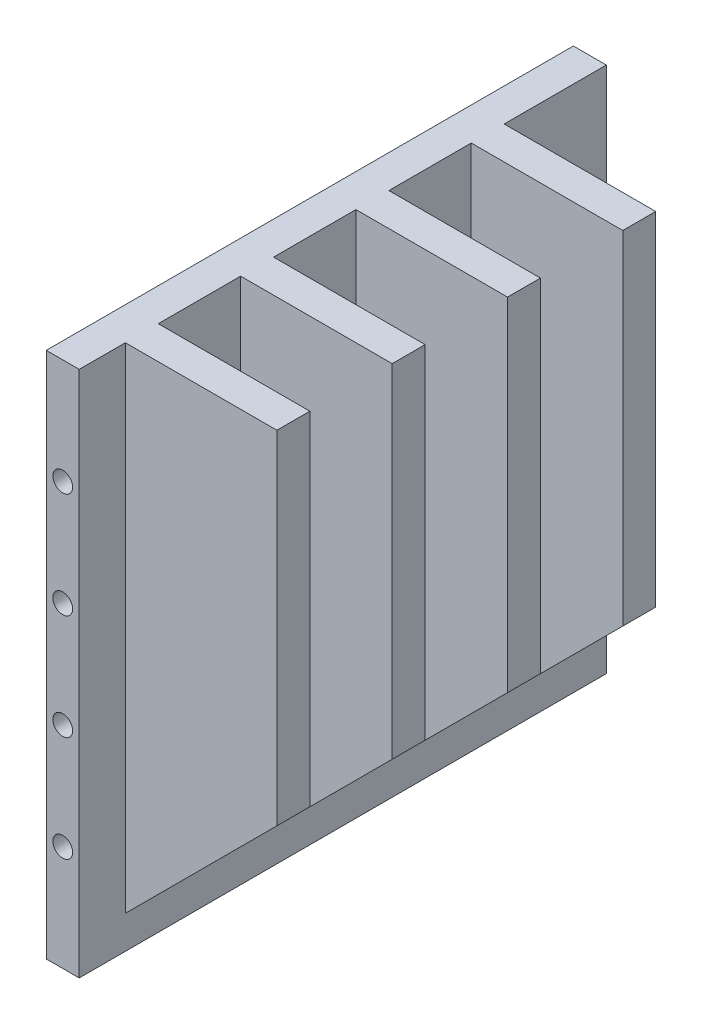
from build123d import *

# Parameters (mm, degrees)
BOSS_EXTRUDE1_DEPTH = 101.6
SKETCH2_R           = 1.905
CUT_EXTRUDE1_DEPTH  = 4.826
SKETCH5_W           = 29.21
SKETCH5_H           = 6.35
BOSS_EXTRUDE2_DEPTH = 57.15
CHAMFER1_SIZE       = 38.1
CUT_EXTRUDE2_START  = -101.6
SKETCH2_2_R         = 1.905
CUT_EXTRUDE2_DEPTH  = 4.826


with BuildPart() as part:
    # Sketch1 → Boss-Extrude1 (new body)
    with BuildSketch(Plane(origin=(0, 0, 0), x_dir=(1, 0, 0), z_dir=(0, 1, 0))):
        Polygon((0, -19.05), (0, 19.05), (0, 52.07), (6.35, 52.07), (6.35, 19.05), (6.35, -19.05), (6.35, -49.53), (0, -49.53), align=None)
    extrude(amount=BOSS_EXTRUDE1_DEPTH)

    # Sketch2 → Cut-Extrude1 (cut)
    with BuildSketch(Plane.XY.offset(49.53)):
        with Locations((3.175, 81.28)):
            Circle(SKETCH2_R)
        with Locations((3.175, 60.96)):
            Circle(SKETCH2_R)
        with Locations((3.175, 20.32)):
            Circle(SKETCH2_R)
        with Locations((3.175, 40.64)):
            Circle(SKETCH2_R)
    cut_extrude1 = extrude(amount=-CUT_EXTRUDE1_DEPTH, mode=Mode.SUBTRACT)

    # Mirror1: Cut-Extrude1 across plane
    add(cut_extrude1.mirror(Plane.XY), mode=Mode.SUBTRACT)

    # Sketch5 → Boss-Extrude2 (add)
    with BuildSketch(Plane(origin=(0, 101.6, 0), x_dir=(1, 0, 0), z_dir=(0, 1, 0))):
        with Locations((20.955, 29.21)):
            Rectangle(SKETCH5_W, SKETCH5_H)
        with Locations((20.955, 6.985)):
            Rectangle(SKETCH5_W, SKETCH5_H)
        with Locations((20.955, -15.24)):
            Rectangle(SKETCH5_W, SKETCH5_H)
        with Locations((20.955, -37.465)):
            Rectangle(SKETCH5_W, SKETCH5_H)
    extrude(amount=-BOSS_EXTRUDE2_DEPTH)

    # Chamfer1
    # the kernel refuses this chamfer: 38.1 mm, written as the material it adds along each edge
    with BuildSketch(Plane(origin=(6.35, 44.45, 71.946121842), x_dir=(-0.02749587661058638, -0.9996219169112968, 0), z_dir=(0, 0, -1))) as chamfer1_piece_1_section:
        Polygon((CHAMFER1_SIZE * 0.999621916911, -CHAMFER1_SIZE * 0.0274958766106), (-CHAMFER1_SIZE * 0.0274958766106, -CHAMFER1_SIZE * 0.999621916911), (0, 0), align=None)
    chamfer1_piece_1 = extrude(amount=104.331121842, mode=Mode.PRIVATE)
    chamfer1_piece_1 = split(chamfer1_piece_1, bisect_by=Plane(origin=(17.461394365, 31.123016765, 40.64), z_dir=(0, 0, -1)), keep=Keep.TOP, mode=Mode.PRIVATE)
    chamfer1_piece_1 = split(chamfer1_piece_1, bisect_by=Plane(origin=(17.461394365, 31.123016765, 34.29), z_dir=(0, 0, 1)), keep=Keep.TOP, mode=Mode.PRIVATE)
    chamfer1_piece_1 = split(chamfer1_piece_1, bisect_by=Plane(origin=(35.56, 31.123016765, 37.465), z_dir=(-1, 0, 0)), keep=Keep.TOP, mode=Mode.PRIVATE)
    add(chamfer1_piece_1)
    with BuildSketch(Plane(origin=(6.35, 44.45, 71.946121842), x_dir=(-0.02749587661058638, -0.9996219169112968, 0), z_dir=(0, 0, -1))) as chamfer1_piece_2_section:
        Polygon((CHAMFER1_SIZE * 0.999621916911, -CHAMFER1_SIZE * 0.0274958766106), (-CHAMFER1_SIZE * 0.0274958766106, -CHAMFER1_SIZE * 0.999621916911), (0, 0), align=None)
    chamfer1_piece_2 = extrude(amount=104.331121842, mode=Mode.PRIVATE)
    chamfer1_piece_2 = split(chamfer1_piece_2, bisect_by=Plane(origin=(35.56, 31.123016765, 15.24), z_dir=(-1, 0, 0)), keep=Keep.TOP, mode=Mode.PRIVATE)
    chamfer1_piece_2 = split(chamfer1_piece_2, bisect_by=Plane(origin=(17.461394365, 31.123016765, 18.415), z_dir=(0, 0, -1)), keep=Keep.TOP, mode=Mode.PRIVATE)
    chamfer1_piece_2 = split(chamfer1_piece_2, bisect_by=Plane(origin=(17.461394365, 31.123016765, 12.065), z_dir=(0, 0, 1)), keep=Keep.TOP, mode=Mode.PRIVATE)
    add(chamfer1_piece_2)
    with BuildSketch(Plane(origin=(6.35, 44.45, 71.946121842), x_dir=(-0.02749587661058638, -0.9996219169112968, 0), z_dir=(0, 0, -1))) as chamfer1_piece_3_section:
        Polygon((CHAMFER1_SIZE * 0.999621916911, -CHAMFER1_SIZE * 0.0274958766106), (-CHAMFER1_SIZE * 0.0274958766106, -CHAMFER1_SIZE * 0.999621916911), (0, 0), align=None)
    chamfer1_piece_3 = extrude(amount=104.331121842, mode=Mode.PRIVATE)
    chamfer1_piece_3 = split(chamfer1_piece_3, bisect_by=Plane(origin=(35.56, 31.123016765, -6.985), z_dir=(-1, 0, 0)), keep=Keep.TOP, mode=Mode.PRIVATE)
    chamfer1_piece_3 = split(chamfer1_piece_3, bisect_by=Plane(origin=(17.461394365, 31.123016765, -3.81), z_dir=(0, 0, -1)), keep=Keep.TOP, mode=Mode.PRIVATE)
    chamfer1_piece_3 = split(chamfer1_piece_3, bisect_by=Plane(origin=(17.461394365, 31.123016765, -10.16), z_dir=(0, 0, 1)), keep=Keep.TOP, mode=Mode.PRIVATE)
    add(chamfer1_piece_3)
    with BuildSketch(Plane(origin=(6.35, 44.45, -26.035), x_dir=(-0.027495876610586018, -0.9996219169112968, 0), z_dir=(0, 0, -1))) as chamfer1_piece_4_section:
        Polygon((CHAMFER1_SIZE * 0.999621916911, -CHAMFER1_SIZE * 0.0274958766106), (-CHAMFER1_SIZE * 0.0274958766106, -CHAMFER1_SIZE * 0.999621916911), (0, 0), align=None)
    chamfer1_piece_4 = extrude(amount=6.35, mode=Mode.PRIVATE)
    chamfer1_piece_4 = split(chamfer1_piece_4, bisect_by=Plane(origin=(35.56, 31.123016765, -29.21), z_dir=(-1, 0, 0)), keep=Keep.TOP, mode=Mode.PRIVATE)
    add(chamfer1_piece_4)
    with BuildSketch(Plane(origin=(6.35, 44.45, 94.171121842), x_dir=(-0.02749587661058638, -0.9996219169112968, 0), z_dir=(0, 0, -1))) as chamfer1_piece_5_section:
        Polygon((CHAMFER1_SIZE * 0.999621916911, -CHAMFER1_SIZE * 0.0274958766106), (-CHAMFER1_SIZE * 0.0274958766106, -CHAMFER1_SIZE * 0.999621916911), (0, 0), align=None)
    chamfer1_piece_5 = extrude(amount=104.331121842, mode=Mode.PRIVATE)
    chamfer1_piece_5 = split(chamfer1_piece_5, bisect_by=Plane(origin=(17.461394365, 31.123016765, 40.64), z_dir=(0, 0, -1)), keep=Keep.TOP, mode=Mode.PRIVATE)
    chamfer1_piece_5 = split(chamfer1_piece_5, bisect_by=Plane(origin=(17.461394365, 31.123016765, 34.29), z_dir=(0, 0, 1)), keep=Keep.TOP, mode=Mode.PRIVATE)
    chamfer1_piece_5 = split(chamfer1_piece_5, bisect_by=Plane(origin=(35.56, 31.123016765, 37.465), z_dir=(-1, 0, 0)), keep=Keep.TOP, mode=Mode.PRIVATE)
    add(chamfer1_piece_5)
    with BuildSketch(Plane(origin=(6.35, 44.45, 94.171121842), x_dir=(-0.02749587661058638, -0.9996219169112968, 0), z_dir=(0, 0, -1))) as chamfer1_piece_6_section:
        Polygon((CHAMFER1_SIZE * 0.999621916911, -CHAMFER1_SIZE * 0.0274958766106), (-CHAMFER1_SIZE * 0.0274958766106, -CHAMFER1_SIZE * 0.999621916911), (0, 0), align=None)
    chamfer1_piece_6 = extrude(amount=104.331121842, mode=Mode.PRIVATE)
    chamfer1_piece_6 = split(chamfer1_piece_6, bisect_by=Plane(origin=(35.56, 31.123016765, 15.24), z_dir=(-1, 0, 0)), keep=Keep.TOP, mode=Mode.PRIVATE)
    chamfer1_piece_6 = split(chamfer1_piece_6, bisect_by=Plane(origin=(17.461394365, 31.123016765, 18.415), z_dir=(0, 0, -1)), keep=Keep.TOP, mode=Mode.PRIVATE)
    chamfer1_piece_6 = split(chamfer1_piece_6, bisect_by=Plane(origin=(17.461394365, 31.123016765, 12.065), z_dir=(0, 0, 1)), keep=Keep.TOP, mode=Mode.PRIVATE)
    add(chamfer1_piece_6)
    with BuildSketch(Plane(origin=(6.35, 44.45, -3.81), x_dir=(-0.027495876610585814, -0.9996219169112968, 0), z_dir=(0, 0, -1))) as chamfer1_piece_7_section:
        Polygon((CHAMFER1_SIZE * 0.999621916911, -CHAMFER1_SIZE * 0.0274958766106), (-CHAMFER1_SIZE * 0.0274958766106, -CHAMFER1_SIZE * 0.999621916911), (0, 0), align=None)
    chamfer1_piece_7 = extrude(amount=6.35, mode=Mode.PRIVATE)
    chamfer1_piece_7 = split(chamfer1_piece_7, bisect_by=Plane(origin=(35.56, 31.123016765, -6.985), z_dir=(-1, 0, 0)), keep=Keep.TOP, mode=Mode.PRIVATE)
    add(chamfer1_piece_7)
    with BuildSketch(Plane(origin=(6.35, 44.45, -3.81), x_dir=(-0.027495876610585814, -0.9996219169112968, 0), z_dir=(0, 0, -1))) as chamfer1_piece_8_section:
        Polygon((CHAMFER1_SIZE * 0.999621916911, -CHAMFER1_SIZE * 0.0274958766106), (-CHAMFER1_SIZE * 0.0274958766106, -CHAMFER1_SIZE * 0.999621916911), (0, 0), align=None)
    chamfer1_piece_8 = extrude(amount=104.331121842, mode=Mode.PRIVATE)
    chamfer1_piece_8 = split(chamfer1_piece_8, bisect_by=Plane(origin=(35.56, 31.123016765, -29.21), z_dir=(-1, 0, 0)), keep=Keep.TOP, mode=Mode.PRIVATE)
    chamfer1_piece_8 = split(chamfer1_piece_8, bisect_by=Plane(origin=(17.461394365, 31.123016765, -26.035), z_dir=(0, 0, -1)), keep=Keep.TOP, mode=Mode.PRIVATE)
    chamfer1_piece_8 = split(chamfer1_piece_8, bisect_by=Plane(origin=(17.461394365, 31.123016765, -32.385), z_dir=(0, 0, 1)), keep=Keep.TOP, mode=Mode.PRIVATE)
    add(chamfer1_piece_8)
    with BuildSketch(Plane(origin=(6.35, 44.45, 116.396121842), x_dir=(-0.02749587661058638, -0.9996219169112968, 0), z_dir=(0, 0, -1))) as chamfer1_piece_9_section:
        Polygon((CHAMFER1_SIZE * 0.999621916911, -CHAMFER1_SIZE * 0.0274958766106), (-CHAMFER1_SIZE * 0.0274958766106, -CHAMFER1_SIZE * 0.999621916911), (0, 0), align=None)
    chamfer1_piece_9 = extrude(amount=104.331121842, mode=Mode.PRIVATE)
    chamfer1_piece_9 = split(chamfer1_piece_9, bisect_by=Plane(origin=(17.461394365, 31.123016765, 40.64), z_dir=(0, 0, -1)), keep=Keep.TOP, mode=Mode.PRIVATE)
    chamfer1_piece_9 = split(chamfer1_piece_9, bisect_by=Plane(origin=(17.461394365, 31.123016765, 34.29), z_dir=(0, 0, 1)), keep=Keep.TOP, mode=Mode.PRIVATE)
    chamfer1_piece_9 = split(chamfer1_piece_9, bisect_by=Plane(origin=(35.56, 31.123016765, 37.465), z_dir=(-1, 0, 0)), keep=Keep.TOP, mode=Mode.PRIVATE)
    add(chamfer1_piece_9)
    with BuildSketch(Plane(origin=(6.35, 44.45, 18.415), x_dir=(-0.02749587661058561, -0.9996219169112968, 0), z_dir=(0, 0, -1))) as chamfer1_piece_10_section:
        Polygon((CHAMFER1_SIZE * 0.999621916911, -CHAMFER1_SIZE * 0.0274958766106), (-CHAMFER1_SIZE * 0.0274958766106, -CHAMFER1_SIZE * 0.999621916911), (0, 0), align=None)
    chamfer1_piece_10 = extrude(amount=6.35, mode=Mode.PRIVATE)
    chamfer1_piece_10 = split(chamfer1_piece_10, bisect_by=Plane(origin=(35.56, 31.123016765, 15.24), z_dir=(-1, 0, 0)), keep=Keep.TOP, mode=Mode.PRIVATE)
    add(chamfer1_piece_10)
    with BuildSketch(Plane(origin=(6.35, 44.45, 18.415), x_dir=(-0.02749587661058561, -0.9996219169112968, 0), z_dir=(0, 0, -1))) as chamfer1_piece_11_section:
        Polygon((CHAMFER1_SIZE * 0.999621916911, -CHAMFER1_SIZE * 0.0274958766106), (-CHAMFER1_SIZE * 0.0274958766106, -CHAMFER1_SIZE * 0.999621916911), (0, 0), align=None)
    chamfer1_piece_11 = extrude(amount=104.331121842, mode=Mode.PRIVATE)
    chamfer1_piece_11 = split(chamfer1_piece_11, bisect_by=Plane(origin=(35.56, 31.123016765, -6.985), z_dir=(-1, 0, 0)), keep=Keep.TOP, mode=Mode.PRIVATE)
    chamfer1_piece_11 = split(chamfer1_piece_11, bisect_by=Plane(origin=(17.461394365, 31.123016765, -3.81), z_dir=(0, 0, -1)), keep=Keep.TOP, mode=Mode.PRIVATE)
    chamfer1_piece_11 = split(chamfer1_piece_11, bisect_by=Plane(origin=(17.461394365, 31.123016765, -10.16), z_dir=(0, 0, 1)), keep=Keep.TOP, mode=Mode.PRIVATE)
    add(chamfer1_piece_11)
    with BuildSketch(Plane(origin=(6.35, 44.45, 18.415), x_dir=(-0.02749587661058561, -0.9996219169112968, 0), z_dir=(0, 0, -1))) as chamfer1_piece_12_section:
        Polygon((CHAMFER1_SIZE * 0.999621916911, -CHAMFER1_SIZE * 0.0274958766106), (-CHAMFER1_SIZE * 0.0274958766106, -CHAMFER1_SIZE * 0.999621916911), (0, 0), align=None)
    chamfer1_piece_12 = extrude(amount=104.331121842, mode=Mode.PRIVATE)
    chamfer1_piece_12 = split(chamfer1_piece_12, bisect_by=Plane(origin=(35.56, 31.123016765, -29.21), z_dir=(-1, 0, 0)), keep=Keep.TOP, mode=Mode.PRIVATE)
    chamfer1_piece_12 = split(chamfer1_piece_12, bisect_by=Plane(origin=(17.461394365, 31.123016765, -26.035), z_dir=(0, 0, -1)), keep=Keep.TOP, mode=Mode.PRIVATE)
    chamfer1_piece_12 = split(chamfer1_piece_12, bisect_by=Plane(origin=(17.461394365, 31.123016765, -32.385), z_dir=(0, 0, 1)), keep=Keep.TOP, mode=Mode.PRIVATE)
    add(chamfer1_piece_12)
    with BuildSketch(Plane(origin=(6.35, 44.45, 40.64), x_dir=(-0.02749587661058536, -0.9996219169112968, 0), z_dir=(0, 0, -1))) as chamfer1_piece_13_section:
        Polygon((CHAMFER1_SIZE * 0.999621916911, -CHAMFER1_SIZE * 0.0274958766106), (-CHAMFER1_SIZE * 0.0274958766106, -CHAMFER1_SIZE * 0.999621916911), (0, 0), align=None)
    chamfer1_piece_13 = extrude(amount=6.35, mode=Mode.PRIVATE)
    chamfer1_piece_13 = split(chamfer1_piece_13, bisect_by=Plane(origin=(35.56, 31.123016765, 37.465), z_dir=(-1, 0, 0)), keep=Keep.TOP, mode=Mode.PRIVATE)
    add(chamfer1_piece_13)
    with BuildSketch(Plane(origin=(6.35, 44.45, 40.64), x_dir=(-0.02749587661058536, -0.9996219169112968, 0), z_dir=(0, 0, -1))) as chamfer1_piece_14_section:
        Polygon((CHAMFER1_SIZE * 0.999621916911, -CHAMFER1_SIZE * 0.0274958766106), (-CHAMFER1_SIZE * 0.0274958766106, -CHAMFER1_SIZE * 0.999621916911), (0, 0), align=None)
    chamfer1_piece_14 = extrude(amount=104.331121842, mode=Mode.PRIVATE)
    chamfer1_piece_14 = split(chamfer1_piece_14, bisect_by=Plane(origin=(35.56, 31.123016765, 15.24), z_dir=(-1, 0, 0)), keep=Keep.TOP, mode=Mode.PRIVATE)
    chamfer1_piece_14 = split(chamfer1_piece_14, bisect_by=Plane(origin=(17.461394365, 31.123016765, 18.415), z_dir=(0, 0, -1)), keep=Keep.TOP, mode=Mode.PRIVATE)
    chamfer1_piece_14 = split(chamfer1_piece_14, bisect_by=Plane(origin=(17.461394365, 31.123016765, 12.065), z_dir=(0, 0, 1)), keep=Keep.TOP, mode=Mode.PRIVATE)
    add(chamfer1_piece_14)
    with BuildSketch(Plane(origin=(6.35, 44.45, 40.64), x_dir=(-0.02749587661058536, -0.9996219169112968, 0), z_dir=(0, 0, -1))) as chamfer1_piece_15_section:
        Polygon((CHAMFER1_SIZE * 0.999621916911, -CHAMFER1_SIZE * 0.0274958766106), (-CHAMFER1_SIZE * 0.0274958766106, -CHAMFER1_SIZE * 0.999621916911), (0, 0), align=None)
    chamfer1_piece_15 = extrude(amount=104.331121842, mode=Mode.PRIVATE)
    chamfer1_piece_15 = split(chamfer1_piece_15, bisect_by=Plane(origin=(35.56, 31.123016765, -6.985), z_dir=(-1, 0, 0)), keep=Keep.TOP, mode=Mode.PRIVATE)
    chamfer1_piece_15 = split(chamfer1_piece_15, bisect_by=Plane(origin=(17.461394365, 31.123016765, -3.81), z_dir=(0, 0, -1)), keep=Keep.TOP, mode=Mode.PRIVATE)
    chamfer1_piece_15 = split(chamfer1_piece_15, bisect_by=Plane(origin=(17.461394365, 31.123016765, -10.16), z_dir=(0, 0, 1)), keep=Keep.TOP, mode=Mode.PRIVATE)
    add(chamfer1_piece_15)
    with BuildSketch(Plane(origin=(6.35, 44.45, 40.64), x_dir=(-0.02749587661058536, -0.9996219169112968, 0), z_dir=(0, 0, -1))) as chamfer1_piece_16_section:
        Polygon((CHAMFER1_SIZE * 0.999621916911, -CHAMFER1_SIZE * 0.0274958766106), (-CHAMFER1_SIZE * 0.0274958766106, -CHAMFER1_SIZE * 0.999621916911), (0, 0), align=None)
    chamfer1_piece_16 = extrude(amount=104.331121842, mode=Mode.PRIVATE)
    chamfer1_piece_16 = split(chamfer1_piece_16, bisect_by=Plane(origin=(35.56, 31.123016765, -29.21), z_dir=(-1, 0, 0)), keep=Keep.TOP, mode=Mode.PRIVATE)
    chamfer1_piece_16 = split(chamfer1_piece_16, bisect_by=Plane(origin=(17.461394365, 31.123016765, -26.035), z_dir=(0, 0, -1)), keep=Keep.TOP, mode=Mode.PRIVATE)
    chamfer1_piece_16 = split(chamfer1_piece_16, bisect_by=Plane(origin=(17.461394365, 31.123016765, -32.385), z_dir=(0, 0, 1)), keep=Keep.TOP, mode=Mode.PRIVATE)
    add(chamfer1_piece_16)

    # Sketch2<2> → Cut-Extrude2 (cut)
    with BuildSketch(Plane.XY.offset(49.53).offset(CUT_EXTRUDE2_START)):
        with Locations((3.175, 81.28)):
            Circle(SKETCH2_2_R)
        with Locations((3.175, 60.96)):
            Circle(SKETCH2_2_R)
        with Locations((3.175, 20.32)):
            Circle(SKETCH2_2_R)
        with Locations((3.175, 40.64)):
            Circle(SKETCH2_2_R)
    extrude(amount=CUT_EXTRUDE2_DEPTH, mode=Mode.SUBTRACT)


solid = part.part
